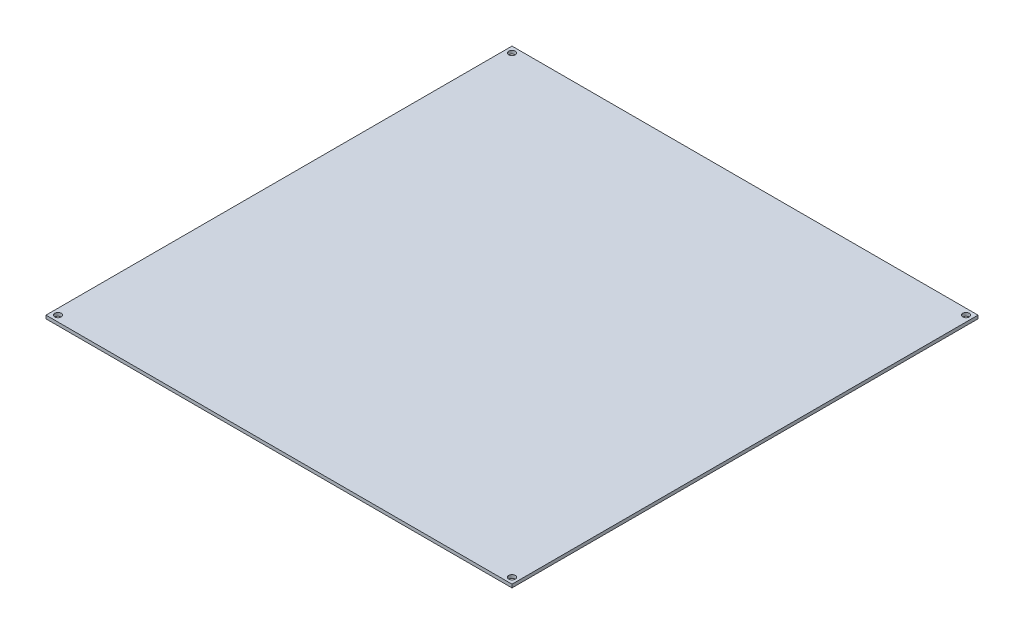
from build123d import *

# Parameters (mm, degrees)
CROQUIS1_W              = 214
CROQUIS1_H              = 214
CROQUIS1_R              = 1.5
SALIENTE_EXTRUIR2_DEPTH = 1.5


with BuildPart() as part:
    # Croquis1 → Saliente-Extruir2 (new body)
    with BuildSketch(Plane(origin=(0, 0, 0), x_dir=(1, 0, 0), z_dir=(0, 1, 0))):
        with Locations((-18.043137255, -45.317647059)):
            Rectangle(CROQUIS1_W, CROQUIS1_H)
        with Locations((-122.293137255, 58.932352941)):
            Circle(CROQUIS1_R, mode=Mode.SUBTRACT)
        with Locations((86.206862745, 58.932352941)):
            Circle(CROQUIS1_R, mode=Mode.SUBTRACT)
        with Locations((-122.293137255, -149.567647059)):
            Circle(CROQUIS1_R, mode=Mode.SUBTRACT)
        with Locations((86.206862745, -149.567647059)):
            Circle(CROQUIS1_R, mode=Mode.SUBTRACT)
    extrude(amount=SALIENTE_EXTRUIR2_DEPTH)


solid = part.part
